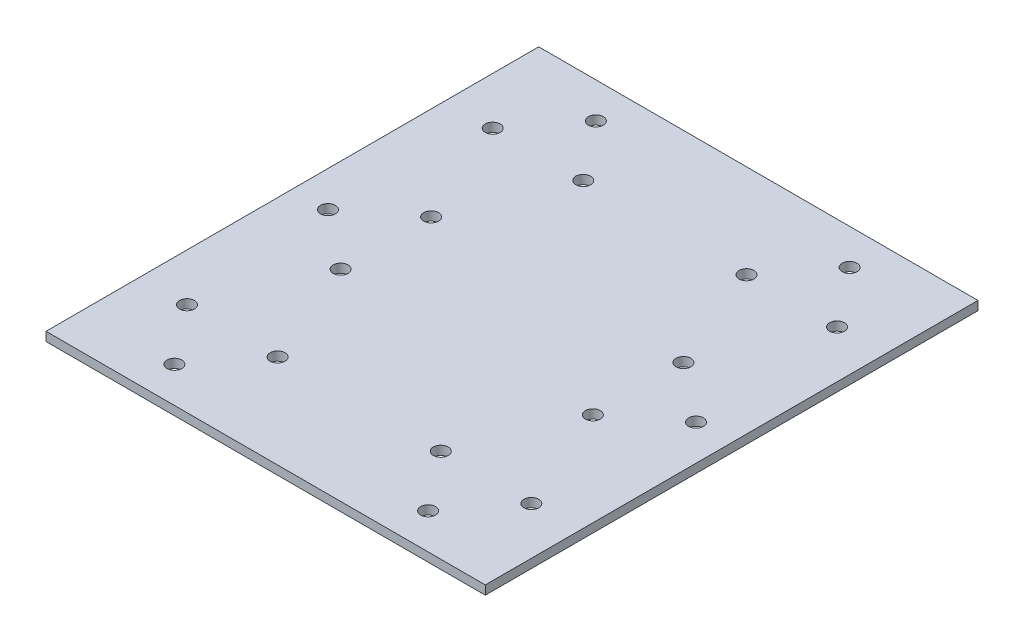
from build123d import *

# Parameters (mm, degrees)
SKETCH_1_W          = 148
SKETCH_1_H          = 166
EXTRUDE_1_DEPTH     = 3
SKETCH_2_R          = 2.5
CUT_EXTRUDE_1_DEPTH = 112.23848255


with BuildPart() as part:
    # 草图1 → 凸台-拉伸1 (new body)
    with BuildSketch(Plane(origin=(0, 0, 0), x_dir=(1, 0, 0), z_dir=(0, 1, 0))):
        Rectangle(SKETCH_1_W, SKETCH_1_H)
    extrude(amount=EXTRUDE_1_DEPTH)

    # 草图2 → 切除-拉伸1 (cut, through all)
    with BuildSketch(Plane(origin=(0, 3, 0), x_dir=(1, 0, 0), z_dir=(0, 1, 0))):
        with Locations((-58, 51.5)):
            Circle(SKETCH_2_R)
        with Locations((-27.5, 51.5)):
            Circle(SKETCH_2_R)
        with Locations((-27.5, -51.5)):
            Circle(SKETCH_2_R)
        with Locations((-58, -51.5)):
            Circle(SKETCH_2_R)
        with Locations((58, -51.5)):
            Circle(SKETCH_2_R)
        with Locations((27.5, -51.5)):
            Circle(SKETCH_2_R)
        with Locations((27.5, 51.5)):
            Circle(SKETCH_2_R)
        with Locations((58, 51.5)):
            Circle(SKETCH_2_R)
        with Locations((-42.75, 71)):
            Circle(SKETCH_2_R)
        with Locations((-42.75, -71)):
            Circle(SKETCH_2_R)
        with Locations((42.75, -71)):
            Circle(SKETCH_2_R)
        with Locations((42.75, 71)):
            Circle(SKETCH_2_R)
        with Locations((-62, 0)):
            Circle(SKETCH_2_R)
        with Locations((-42.5, -15.25)):
            Circle(SKETCH_2_R)
        with Locations((-42.5, 15.25)):
            Circle(SKETCH_2_R)
        with Locations((42.5, 15.25)):
            Circle(SKETCH_2_R)
        with Locations((42.5, -15.25)):
            Circle(SKETCH_2_R)
        with Locations((62, 0)):
            Circle(SKETCH_2_R)
    extrude(amount=-CUT_EXTRUDE_1_DEPTH, mode=Mode.SUBTRACT)


solid = part.part
